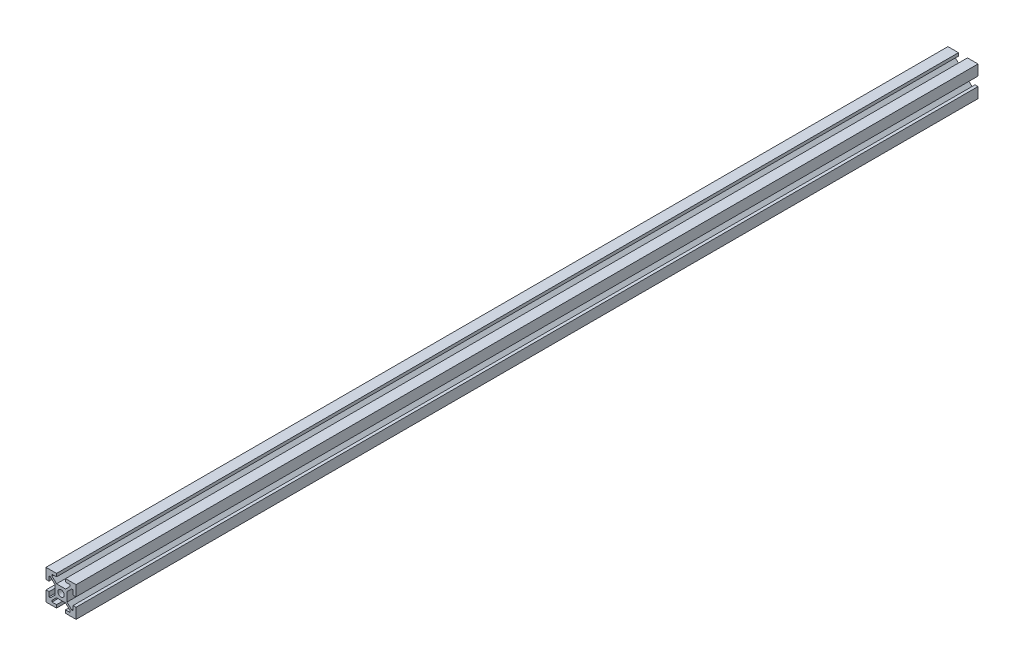
from build123d import *

# Parameters (mm, degrees)
SKETCH_2_R      = 2.1
EXTRUDE_1_DEPTH = 600


with BuildPart() as part:
    # ｽｹｯﾁ2 → ﾎﾞｽ - 押し出し1 (new body)
    with BuildSketch(Plane.XY):
        Polygon((3, 4), (-3, 4), (-6, 7), (-6, 8), (-3, 8), (-3, 10), (-10, 10), (-10, 3), (-8, 3), (-8, 6), (-7, 6), (-4, 3), (-4, -3), (-7, -6), (-8, -6), (-8, -3), (-10, -3), (-10, -10), (-3, -10), (-3, -8), (-6, -8), (-6, -7), (-3, -4), (3, -4), (6, -7), (6, -8), (3, -8), (3, -10), (10, -10), (10, -3), (8, -3), (8, -6), (7, -6), (4, -3), (4, 3), (7, 6), (8, 6), (8, 3), (10, 3), (10, 10), (3, 10), (3, 8), (6, 8), (6, 7), align=None)
        Circle(SKETCH_2_R, mode=Mode.SUBTRACT)
    extrude(amount=EXTRUDE_1_DEPTH)


solid = part.part
